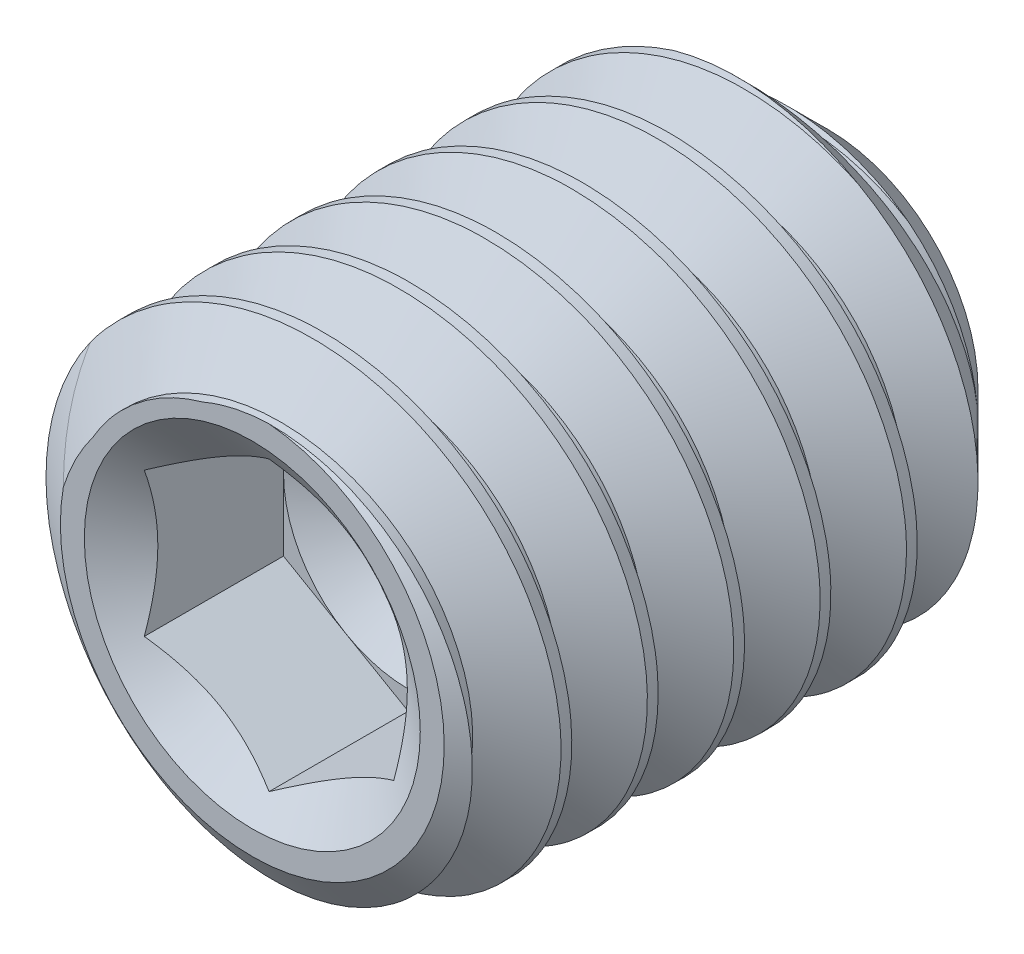
from build123d import *

# Parameters (mm, degrees)
CUT_EXTRUDE3_DEPTH = 0.8125
CUT_SWEEP1_PITCH   = 0.45


with BuildPart() as part:
    # Sketch4 → Revolve1 (revolve)
    with BuildSketch(Plane(origin=(0, 0, 0), x_dir=(0, 0, -1), z_dir=(1, 0, 0))):
        with BuildLine():
            Line((1.317361757, 0), (1.593367806, 0.459351203))
            ThreePointArc((1.593367806, 0.459351203), (1.659907276, 0.614226015), (1.682638243, 0.78125))
            Line((1.682638243, 0.78125), (1.213888243, 1.25))
            Line((1.213888243, 1.25), (-1.142309873, 1.25))
            Line((-1.142309873, 1.25), (-1.317361757, 1))
            Line((-1.317361757, 1), (-1.317361757, 0))
            Line((-1.317361757, 0), (1.317361757, 0))
        make_face()
    revolve(axis=Axis((0, 0, -1.317361757), (0, 0, 1)))

    # Sketch6 → Cut-Extrude3 (cut)
    with BuildSketch(Plane.XY.offset(1.317361757)):
        Polygon((0.65, 0.375277675), (0, 0.75055535), (-0.65, 0.375277675), (-0.65, -0.375277675), (0, -0.75055535), (0.65, -0.375277675), align=None)
    extrude(amount=-CUT_EXTRUDE3_DEPTH, mode=Mode.SUBTRACT)

    # Cut-Extrude4 cone 1 section (through the dimple's axis) → Cut-Extrude4 (revolve, cut)
    with BuildSketch(Plane(origin=(0, 0, 1.317361757), x_dir=(0, -1, 0), z_dir=(1, 0, 0))):
        Polygon((0, 0), (0.875277675, 0), (0, 0.612876026), align=None)
    revolve(axis=Axis((0, 0, 1.317361757), (0, 0, -1)), mode=Mode.SUBTRACT)

    # Cut-Extrude5 cone 1 section (through the dimple's axis) → Cut-Extrude5 (revolve, cut)
    with BuildSketch(Plane(origin=(0, 0, 0.504861757), x_dir=(0, -1, 0), z_dir=(1, 0, 0))):
        Polygon((0, 0), (0.65, 0), (0, 0.375277675), align=None)
    revolve(axis=Axis((0, 0, 0.504861757), (0, 0, -1)), mode=Mode.SUBTRACT)

    # Cut-Sweep1: the profile of Sketch10 profile screwed along a right-hand helix of 7.666667 turns, 6 arcs to a turn; built about Z, then put on its axis
    cut_sweep1_z = Axis((0, 0, 0), (0, 0, 1))
    cut_sweep1_corners = [(1.2503, 0, 0.000173205), (1.2503, 0, -0.393923205), (0.957716426, 0, -0.225), (0.957716426, 0, -0.16875)]
    with BuildLine(mode=Mode.PRIVATE) as cut_sweep1_profile:
        Line(cut_sweep1_corners[0], cut_sweep1_corners[1])
        Line(cut_sweep1_corners[1], cut_sweep1_corners[2])
        Line(cut_sweep1_corners[2], cut_sweep1_corners[3])
        Line(cut_sweep1_corners[3], cut_sweep1_corners[0])
    cut_sweep1_cap = Face(cut_sweep1_profile.wire())
    cut_sweep1_turn_angles = [0, 30, 60, 90, 120, 150, 180, 210, 240, 270, 300, 330, 360]
    cut_sweep1_turn_weights = [1, 0.8660254037844387, 1, 0.8660254037844387, 1, 0.8660254037844387, 1, 0.8660254037844387, 1, 0.8660254037844387, 1, 0.8660254037844387, 1]
    cut_sweep1_turn_rails = [Edge.make_bspline([Vector(p[0], p[1], 0).rotate(cut_sweep1_z, cut_sweep1_turn_angles[k]) / cut_sweep1_turn_weights[k] + Vector(0, 0, p[2] + CUT_SWEEP1_PITCH * cut_sweep1_turn_angles[k] / 360) for k in range(13)], [0, 0, 0, 1, 1, 2, 2, 3, 3, 4, 4, 5, 5, 6, 6, 6], 2, cut_sweep1_turn_weights) for p in cut_sweep1_corners]
    cut_sweep1_turn_sides = [Face.make_surface_from_curves(cut_sweep1_turn_rails[p[0]], cut_sweep1_turn_rails[p[1]]) for p in [(0, 1), (1, 2), (2, 3), (3, 0)]]
    cut_sweep1_last_angles = [2520, 2550, 2580, 2610, 2640, 2670, 2700, 2730, 2760]
    cut_sweep1_last_weights = [1, 0.8660254037844387, 1, 0.8660254037844387, 1, 0.8660254037844387, 1, 0.8660254037844168, 1]
    cut_sweep1_last_rails = [Edge.make_bspline([Vector(p[0], p[1], 0).rotate(cut_sweep1_z, cut_sweep1_last_angles[k]) / cut_sweep1_last_weights[k] + Vector(0, 0, p[2] + CUT_SWEEP1_PITCH * cut_sweep1_last_angles[k] / 360) for k in range(9)], [0, 0, 0, 1, 1, 2, 2, 3, 3, 4, 4, 4], 2, cut_sweep1_last_weights) for p in cut_sweep1_corners]
    cut_sweep1_last_sides = [Face.make_surface_from_curves(cut_sweep1_last_rails[p[0]], cut_sweep1_last_rails[p[1]]) for p in [(0, 1), (1, 2), (2, 3), (3, 0)]]
    cut_sweep1 = Plane(origin=(0, 0, -1.682638243), x_dir=(0, 1, 0), z_dir=(0, 0, 1)) * Solid(Shell([*[p.moved(Location((0, 0, CUT_SWEEP1_PITCH * i))) for i in range(7) for p in cut_sweep1_turn_sides], *cut_sweep1_last_sides, cut_sweep1_cap, cut_sweep1_cap.rotate(cut_sweep1_z, 2760).moved(Location((0, 0, CUT_SWEEP1_PITCH * 2760 / 360)))]))
    add(cut_sweep1, mode=Mode.SUBTRACT)


solid = part.part
